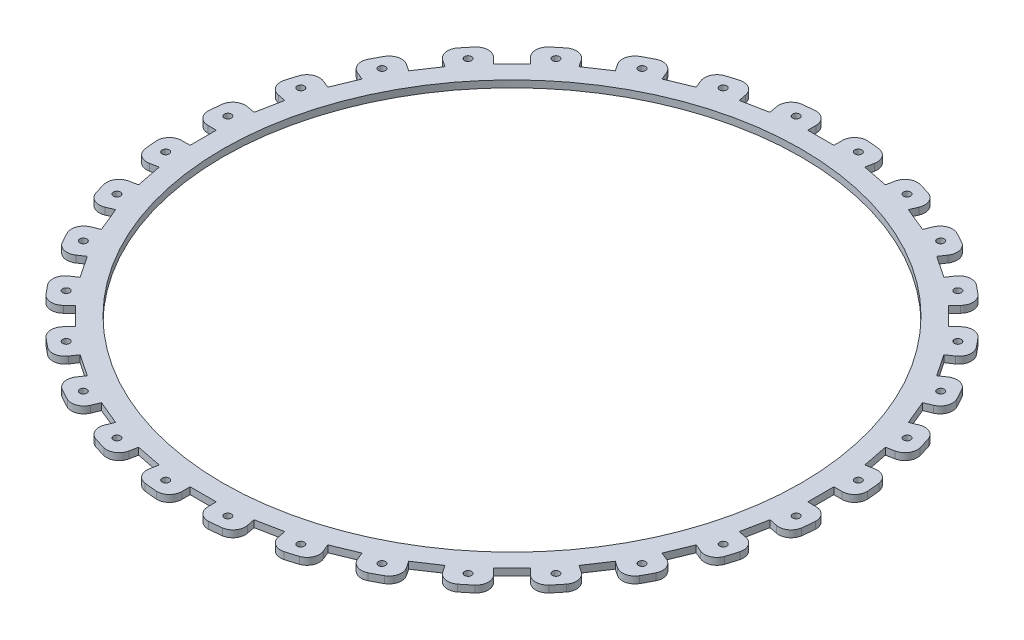
from build123d import *

# Parameters (mm, degrees)
SKETCH1_R           = 133.35
BOSS_EXTRUDE1_DEPTH = 3.175
SKETCH5_R           = 1.6383
CUT_EXTRUDE1_DEPTH  = 216.365801488
CUT_EXTRUDE2_DEPTH  = 216.365801488
CIRPATTERN2_COUNT   = 32


with BuildPart() as part:
    # Sketch1 → Boss-Extrude1 (new body)
    with BuildSketch(Plane(origin=(0, 0, 0), x_dir=(1, 0, 0), z_dir=(0, 1, 0))):
        with BuildLine():
            Line((142.367, 6.0325), (152.016068998, 6.0325))
            ThreePointArc((152.016068998, 6.0325), (152.199347104, 6.110644559), (152.269852085, 6.296994992))
            ThreePointArc((152.269852085, 6.296994992), (151.666152345, 14.937812186), (150.572512355, 23.530374478))
            ThreePointArc((150.572512355, 23.530374478), (150.467006941, 23.6993894), (150.272005226, 23.740276649))
            Line((150.272005226, 23.740276649), (140.808340383, 21.85783667))
            Line((140.808340383, 21.85783667), (138.454575648, 33.691011079))
            Line((138.454575648, 33.691011079), (147.918240491, 35.573451057))
            ThreePointArc((147.918240491, 35.573451057), (148.082751712, 35.685849875), (148.115546794, 35.882374475))
            ThreePointArc((148.115546794, 35.882374475), (145.837707166, 44.239384814), (143.088755417, 52.453484853))
            ThreePointArc((143.088755417, 52.453484853), (142.952304085, 52.598669115), (142.753072566, 52.600727779))
            Line((142.753072566, 52.600727779), (133.838495211, 48.908188936))
            Line((133.838495211, 48.908188936), (129.221419599, 60.054795495))
            Line((129.221419599, 60.054795495), (138.135996955, 63.747334339))
            ThreePointArc((138.135996955, 63.747334339), (138.275419217, 63.889667992), (138.269244103, 64.088814431))
            ThreePointArc((138.269244103, 64.088814431), (134.404800687, 71.840862692), (130.106177854, 79.360837221))
            ThreePointArc((130.106177854, 79.360837221), (129.944024351, 79.476611473), (129.748219385, 79.43976244))
            Line((129.748219385, 79.43976244), (121.725311725, 74.079026928))
            Line((121.725311725, 74.079026928), (115.022356864, 84.110707801))
            Line((115.022356864, 84.110707801), (123.045264523, 89.471443312))
            ThreePointArc((123.045264523, 89.471443312), (123.154239908, 89.638241999), (123.109331904, 89.832357189))
            ThreePointArc((123.109331904, 89.832357189), (117.806793092, 96.681536507), (112.123692839, 103.21839712))
            ThreePointArc((112.123692839, 103.21839712), (111.942068635, 103.300312224), (111.757214896, 103.225971581))
            Line((111.757214896, 103.225971581), (104.934292775, 96.40304946))
            Line((104.934292775, 96.40304946), (96.40304946, 104.934292775))
            Line((96.40304946, 104.934292775), (103.225971581, 111.757214896))
            ThreePointArc((103.225971581, 111.757214896), (103.300312224, 111.942068635), (103.21839712, 112.123692839))
            ThreePointArc((103.21839712, 112.123692839), (96.681536507, 117.806793092), (89.832357189, 123.109331904))
            ThreePointArc((89.832357189, 123.109331904), (89.638241999, 123.154239908), (89.471443312, 123.045264523))
            Line((89.471443312, 123.045264523), (84.110707801, 115.022356864))
            Line((84.110707801, 115.022356864), (74.079026928, 121.725311725))
            Line((74.079026928, 121.725311725), (79.43976244, 129.748219385))
            ThreePointArc((79.43976244, 129.748219385), (79.476611473, 129.944024351), (79.360837221, 130.106177854))
            ThreePointArc((79.360837221, 130.106177854), (71.840862692, 134.404800687), (64.088814431, 138.269244103))
            ThreePointArc((64.088814431, 138.269244103), (63.889667992, 138.275419217), (63.747334339, 138.135996955))
            Line((63.747334339, 138.135996955), (60.054795495, 129.221419599))
            Line((60.054795495, 129.221419599), (48.908188936, 133.838495211))
            Line((48.908188936, 133.838495211), (52.600727779, 142.753072566))
            ThreePointArc((52.600727779, 142.753072566), (52.598669115, 142.952304085), (52.453484853, 143.088755417))
            ThreePointArc((52.453484853, 143.088755417), (44.239384814, 145.837707166), (35.882374475, 148.115546794))
            ThreePointArc((35.882374475, 148.115546794), (35.685849875, 148.082751712), (35.573451057, 147.918240491))
            Line((35.573451057, 147.918240491), (33.691011079, 138.454575648))
            Line((33.691011079, 138.454575648), (21.85783667, 140.808340383))
            Line((21.85783667, 140.808340383), (23.740276649, 150.272005226))
            ThreePointArc((23.740276649, 150.272005226), (23.6993894, 150.467006941), (23.530374478, 150.572512355))
            ThreePointArc((23.530374478, 150.572512355), (14.937812186, 151.666152345), (6.296994992, 152.269852085))
            ThreePointArc((6.296994992, 152.269852085), (6.110644559, 152.199347104), (6.0325, 152.016068998))
            Line((6.0325, 152.016068998), (6.0325, 142.367))
            Line((6.0325, 142.367), (-6.0325, 142.367))
            Line((-6.0325, 142.367), (-6.0325, 152.016068998))
            ThreePointArc((-6.0325, 152.016068998), (-6.110644559, 152.199347104), (-6.296994992, 152.269852085))
            ThreePointArc((-6.296994992, 152.269852085), (-14.937812186, 151.666152345), (-23.530374478, 150.572512355))
            ThreePointArc((-23.530374478, 150.572512355), (-23.6993894, 150.467006941), (-23.740276649, 150.272005226))
            Line((-23.740276649, 150.272005226), (-21.85783667, 140.808340383))
            Line((-21.85783667, 140.808340383), (-33.691011079, 138.454575648))
            Line((-33.691011079, 138.454575648), (-35.573451057, 147.918240491))
            ThreePointArc((-35.573451057, 147.918240491), (-35.685849875, 148.082751712), (-35.882374475, 148.115546794))
            ThreePointArc((-35.882374475, 148.115546794), (-44.239384814, 145.837707166), (-52.453484853, 143.088755417))
            ThreePointArc((-52.453484853, 143.088755417), (-52.598669115, 142.952304085), (-52.600727779, 142.753072566))
            Line((-52.600727779, 142.753072566), (-48.908188936, 133.838495211))
            Line((-48.908188936, 133.838495211), (-60.054795495, 129.221419599))
            Line((-60.054795495, 129.221419599), (-63.747334339, 138.135996955))
            ThreePointArc((-63.747334339, 138.135996955), (-63.889667992, 138.275419217), (-64.088814431, 138.269244103))
            ThreePointArc((-64.088814431, 138.269244103), (-71.840862692, 134.404800687), (-79.360837221, 130.106177854))
            ThreePointArc((-79.360837221, 130.106177854), (-79.476611473, 129.944024351), (-79.43976244, 129.748219385))
            Line((-79.43976244, 129.748219385), (-74.079026928, 121.725311725))
            Line((-74.079026928, 121.725311725), (-84.110707801, 115.022356864))
            Line((-84.110707801, 115.022356864), (-89.471443312, 123.045264523))
            ThreePointArc((-89.471443312, 123.045264523), (-89.638241999, 123.154239908), (-89.832357189, 123.109331904))
            ThreePointArc((-89.832357189, 123.109331904), (-96.681536507, 117.806793092), (-103.21839712, 112.123692839))
            ThreePointArc((-103.21839712, 112.123692839), (-103.300312224, 111.942068635), (-103.225971581, 111.757214896))
            Line((-103.225971581, 111.757214896), (-96.40304946, 104.934292775))
            Line((-96.40304946, 104.934292775), (-104.934292775, 96.40304946))
            Line((-104.934292775, 96.40304946), (-111.757214896, 103.225971581))
            ThreePointArc((-111.757214896, 103.225971581), (-111.942068635, 103.300312224), (-112.123692839, 103.21839712))
            ThreePointArc((-112.123692839, 103.21839712), (-117.806793092, 96.681536507), (-123.109331904, 89.832357189))
            ThreePointArc((-123.109331904, 89.832357189), (-123.154239908, 89.638241999), (-123.045264523, 89.471443312))
            Line((-123.045264523, 89.471443312), (-115.022356864, 84.110707801))
            Line((-115.022356864, 84.110707801), (-121.725311725, 74.079026928))
            Line((-121.725311725, 74.079026928), (-129.748219385, 79.43976244))
            ThreePointArc((-129.748219385, 79.43976244), (-129.944024351, 79.476611473), (-130.106177854, 79.360837221))
            ThreePointArc((-130.106177854, 79.360837221), (-134.404800687, 71.840862692), (-138.269244103, 64.088814431))
            ThreePointArc((-138.269244103, 64.088814431), (-138.275419217, 63.889667992), (-138.135996955, 63.747334339))
            Line((-138.135996955, 63.747334339), (-129.221419599, 60.054795495))
            Line((-129.221419599, 60.054795495), (-133.838495211, 48.908188936))
            Line((-133.838495211, 48.908188936), (-142.753072566, 52.600727779))
            ThreePointArc((-142.753072566, 52.600727779), (-142.952304085, 52.598669115), (-143.088755417, 52.453484853))
            ThreePointArc((-143.088755417, 52.453484853), (-145.837707166, 44.239384814), (-148.115546794, 35.882374475))
            ThreePointArc((-148.115546794, 35.882374475), (-148.082751712, 35.685849875), (-147.918240491, 35.573451057))
            Line((-147.918240491, 35.573451057), (-138.454575648, 33.691011079))
            Line((-138.454575648, 33.691011079), (-140.808340383, 21.85783667))
            Line((-140.808340383, 21.85783667), (-150.272005226, 23.740276649))
            ThreePointArc((-150.272005226, 23.740276649), (-150.467006941, 23.6993894), (-150.572512355, 23.530374478))
            ThreePointArc((-150.572512355, 23.530374478), (-151.666152345, 14.937812186), (-152.269852085, 6.296994992))
            ThreePointArc((-152.269852085, 6.296994992), (-152.199347104, 6.110644559), (-152.016068998, 6.0325))
            Line((-152.016068998, 6.0325), (-142.367, 6.0325))
            Line((-142.367, 6.0325), (-142.367, -6.0325))
            Line((-142.367, -6.0325), (-152.016068998, -6.0325))
            ThreePointArc((-152.016068998, -6.0325), (-152.199347104, -6.110644559), (-152.269852085, -6.296994992))
            ThreePointArc((-152.269852085, -6.296994992), (-151.666152345, -14.937812186), (-150.572512355, -23.530374478))
            ThreePointArc((-150.572512355, -23.530374478), (-150.467006941, -23.6993894), (-150.272005226, -23.740276649))
            Line((-150.272005226, -23.740276649), (-140.808340383, -21.85783667))
            Line((-140.808340383, -21.85783667), (-138.454575648, -33.691011079))
            Line((-138.454575648, -33.691011079), (-147.918240491, -35.573451057))
            ThreePointArc((-147.918240491, -35.573451057), (-148.082751712, -35.685849875), (-148.115546794, -35.882374475))
            ThreePointArc((-148.115546794, -35.882374475), (-145.837707166, -44.239384814), (-143.088755417, -52.453484853))
            ThreePointArc((-143.088755417, -52.453484853), (-142.952304085, -52.598669115), (-142.753072566, -52.600727779))
            Line((-142.753072566, -52.600727779), (-133.838495211, -48.908188936))
            Line((-133.838495211, -48.908188936), (-129.221419599, -60.054795495))
            Line((-129.221419599, -60.054795495), (-138.135996955, -63.747334339))
            ThreePointArc((-138.135996955, -63.747334339), (-138.275419217, -63.889667992), (-138.269244103, -64.088814431))
            ThreePointArc((-138.269244103, -64.088814431), (-134.404800687, -71.840862692), (-130.106177854, -79.360837221))
            ThreePointArc((-130.106177854, -79.360837221), (-129.944024351, -79.476611473), (-129.748219385, -79.43976244))
            Line((-129.748219385, -79.43976244), (-121.725311725, -74.079026928))
            Line((-121.725311725, -74.079026928), (-115.022356864, -84.110707801))
            Line((-115.022356864, -84.110707801), (-123.045264523, -89.471443312))
            ThreePointArc((-123.045264523, -89.471443312), (-123.154239908, -89.638241999), (-123.109331904, -89.832357189))
            ThreePointArc((-123.109331904, -89.832357189), (-117.806793092, -96.681536507), (-112.123692839, -103.21839712))
            ThreePointArc((-112.123692839, -103.21839712), (-111.942068635, -103.300312224), (-111.757214896, -103.225971581))
            Line((-111.757214896, -103.225971581), (-104.934292775, -96.40304946))
            Line((-104.934292775, -96.40304946), (-96.40304946, -104.934292775))
            Line((-96.40304946, -104.934292775), (-103.225971581, -111.757214896))
            ThreePointArc((-103.225971581, -111.757214896), (-103.300312224, -111.942068635), (-103.21839712, -112.123692839))
            ThreePointArc((-103.21839712, -112.123692839), (-96.681536507, -117.806793092), (-89.832357189, -123.109331904))
            ThreePointArc((-89.832357189, -123.109331904), (-89.638241999, -123.154239908), (-89.471443312, -123.045264523))
            Line((-89.471443312, -123.045264523), (-84.110707801, -115.022356864))
            Line((-84.110707801, -115.022356864), (-74.079026928, -121.725311725))
            Line((-74.079026928, -121.725311725), (-79.43976244, -129.748219385))
            ThreePointArc((-79.43976244, -129.748219385), (-79.476611473, -129.944024351), (-79.360837221, -130.106177854))
            ThreePointArc((-79.360837221, -130.106177854), (-71.840862692, -134.404800687), (-64.088814431, -138.269244103))
            ThreePointArc((-64.088814431, -138.269244103), (-63.889667992, -138.275419217), (-63.747334339, -138.135996955))
            Line((-63.747334339, -138.135996955), (-60.054795495, -129.221419599))
            Line((-60.054795495, -129.221419599), (-48.908188936, -133.838495211))
            Line((-48.908188936, -133.838495211), (-52.600727779, -142.753072566))
            ThreePointArc((-52.600727779, -142.753072566), (-52.598669115, -142.952304085), (-52.453484853, -143.088755417))
            ThreePointArc((-52.453484853, -143.088755417), (-44.239384814, -145.837707166), (-35.882374475, -148.115546794))
            ThreePointArc((-35.882374475, -148.115546794), (-35.685849875, -148.082751712), (-35.573451057, -147.918240491))
            Line((-35.573451057, -147.918240491), (-33.691011079, -138.454575648))
            Line((-33.691011079, -138.454575648), (-21.85783667, -140.808340383))
            Line((-21.85783667, -140.808340383), (-23.740276649, -150.272005226))
            ThreePointArc((-23.740276649, -150.272005226), (-23.6993894, -150.467006941), (-23.530374478, -150.572512355))
            ThreePointArc((-23.530374478, -150.572512355), (-14.937812186, -151.666152345), (-6.296994992, -152.269852085))
            ThreePointArc((-6.296994992, -152.269852085), (-6.110644559, -152.199347104), (-6.0325, -152.016068998))
            Line((-6.0325, -152.016068998), (-6.0325, -142.367))
            Line((-6.0325, -142.367), (6.0325, -142.367))
            Line((6.0325, -142.367), (6.0325, -152.016068998))
            ThreePointArc((6.0325, -152.016068998), (6.110644559, -152.199347104), (6.296994992, -152.269852085))
            ThreePointArc((6.296994992, -152.269852085), (14.937812186, -151.666152345), (23.530374478, -150.572512355))
            ThreePointArc((23.530374478, -150.572512355), (23.6993894, -150.467006941), (23.740276649, -150.272005226))
            Line((23.740276649, -150.272005226), (21.85783667, -140.808340383))
            Line((21.85783667, -140.808340383), (33.691011079, -138.454575648))
            Line((33.691011079, -138.454575648), (35.573451057, -147.918240491))
            ThreePointArc((35.573451057, -147.918240491), (35.685849875, -148.082751712), (35.882374475, -148.115546794))
            ThreePointArc((35.882374475, -148.115546794), (44.239384814, -145.837707166), (52.453484853, -143.088755417))
            ThreePointArc((52.453484853, -143.088755417), (52.598669115, -142.952304085), (52.600727779, -142.753072566))
            Line((52.600727779, -142.753072566), (48.908188936, -133.838495211))
            Line((48.908188936, -133.838495211), (60.054795495, -129.221419599))
            Line((60.054795495, -129.221419599), (63.747334339, -138.135996955))
            ThreePointArc((63.747334339, -138.135996955), (63.889667992, -138.275419217), (64.088814431, -138.269244103))
            ThreePointArc((64.088814431, -138.269244103), (71.840862692, -134.404800687), (79.360837221, -130.106177854))
            ThreePointArc((79.360837221, -130.106177854), (79.476611473, -129.944024351), (79.43976244, -129.748219385))
            Line((79.43976244, -129.748219385), (74.079026928, -121.725311725))
            Line((74.079026928, -121.725311725), (84.110707801, -115.022356864))
            Line((84.110707801, -115.022356864), (89.471443312, -123.045264523))
            ThreePointArc((89.471443312, -123.045264523), (89.638241999, -123.154239908), (89.832357189, -123.109331904))
            ThreePointArc((89.832357189, -123.109331904), (96.681536507, -117.806793092), (103.21839712, -112.123692839))
            ThreePointArc((103.21839712, -112.123692839), (103.300312224, -111.942068635), (103.225971581, -111.757214896))
            Line((103.225971581, -111.757214896), (96.40304946, -104.934292775))
            Line((96.40304946, -104.934292775), (104.934292775, -96.40304946))
            Line((104.934292775, -96.40304946), (111.757214896, -103.225971581))
            ThreePointArc((111.757214896, -103.225971581), (111.942068635, -103.300312224), (112.123692839, -103.21839712))
            ThreePointArc((112.123692839, -103.21839712), (117.806793092, -96.681536507), (123.109331904, -89.832357189))
            ThreePointArc((123.109331904, -89.832357189), (123.154239908, -89.638241999), (123.045264523, -89.471443312))
            Line((123.045264523, -89.471443312), (115.022356864, -84.110707801))
            Line((115.022356864, -84.110707801), (121.725311725, -74.079026928))
            Line((121.725311725, -74.079026928), (129.748219385, -79.43976244))
            ThreePointArc((129.748219385, -79.43976244), (129.944024351, -79.476611473), (130.106177854, -79.360837221))
            ThreePointArc((130.106177854, -79.360837221), (134.404800687, -71.840862692), (138.269244103, -64.088814431))
            ThreePointArc((138.269244103, -64.088814431), (138.275419217, -63.889667992), (138.135996955, -63.747334339))
            Line((138.135996955, -63.747334339), (129.221419599, -60.054795495))
            Line((129.221419599, -60.054795495), (133.838495211, -48.908188936))
            Line((133.838495211, -48.908188936), (142.753072566, -52.600727779))
            ThreePointArc((142.753072566, -52.600727779), (142.952304085, -52.598669115), (143.088755417, -52.453484853))
            ThreePointArc((143.088755417, -52.453484853), (145.837707166, -44.239384814), (148.115546794, -35.882374475))
            ThreePointArc((148.115546794, -35.882374475), (148.082751712, -35.685849875), (147.918240491, -35.573451057))
            Line((147.918240491, -35.573451057), (138.454575648, -33.691011079))
            Line((138.454575648, -33.691011079), (140.808340383, -21.85783667))
            Line((140.808340383, -21.85783667), (150.272005226, -23.740276649))
            ThreePointArc((150.272005226, -23.740276649), (150.467006941, -23.6993894), (150.572512355, -23.530374478))
            ThreePointArc((150.572512355, -23.530374478), (151.666152345, -14.937812186), (152.269852085, -6.296994992))
            ThreePointArc((152.269852085, -6.296994992), (152.199347104, -6.110644559), (152.016068998, -6.0325))
            Line((152.016068998, -6.0325), (142.367, -6.0325))
            Line((142.367, -6.0325), (142.367, 6.0325))
        make_face()
        Circle(SKETCH1_R, mode=Mode.SUBTRACT)
    extrude(amount=BOSS_EXTRUDE1_DEPTH)

    # Sketch5 → Cut-Extrude1 (cut, through all)
    with BuildSketch(Plane.XZ):
        with Locations((-112.898176714, 92.653139152)):
            Circle(SKETCH5_R)
    cut_extrude1 = extrude(amount=-CUT_EXTRUDE1_DEPTH, mode=Mode.SUBTRACT)

    # Sketch5<3> → Cut-Extrude2 (cut, through all)
    with BuildSketch(Plane.XZ):
        with BuildLine():
            Line((-107.628369611, 99.097126296), (-111.944238253, 103.412994938))
            ThreePointArc((-111.944238253, 103.412994938), (-113.978548188, 101.16644974), (-115.967781599, 98.879894978))
            ThreePointArc((-115.967781599, 98.879894978), (-111.844731757, 100.779619198), (-107.628369611, 99.097126296))
        make_face()
        with BuildLine():
            ThreePointArc((-119.604137378, 94.448982641), (-121.458676444, 92.051887088), (-123.265180726, 89.618386621))
            Line((-123.265180726, 89.618386621), (-118.190256087, 86.227430388))
            ThreePointArc((-118.190256087, 86.227430388), (-120.662991808, 90.034538236), (-119.604137378, 94.448982641))
        make_face()
    cut_extrude2 = extrude(amount=-CUT_EXTRUDE2_DEPTH, mode=Mode.SUBTRACT)

    # CirPattern2: Cut-Extrude1, Cut-Extrude2 ×32 about axis
    cirpattern2_axis = Axis((0, 50, 0), (0, -1, 0))
    add([cut_extrude1.rotate(cirpattern2_axis, i * 360 / CIRPATTERN2_COUNT) for i in range(1, CIRPATTERN2_COUNT)], mode=Mode.SUBTRACT)
    add([cut_extrude2.rotate(cirpattern2_axis, i * 360 / CIRPATTERN2_COUNT) for i in range(1, CIRPATTERN2_COUNT)], mode=Mode.SUBTRACT)


solid = part.part
